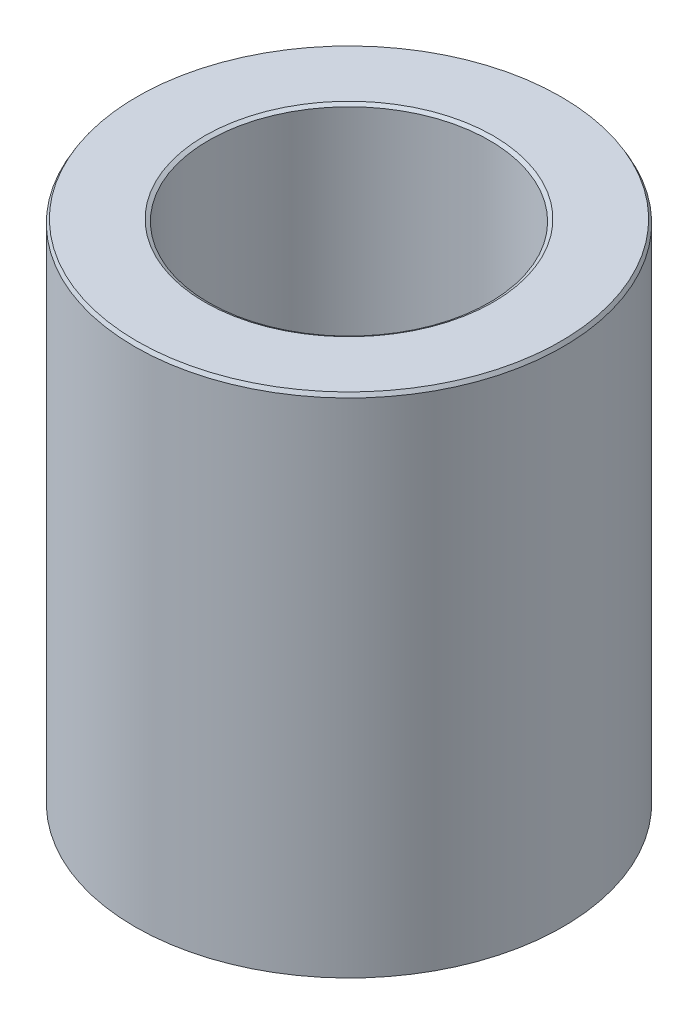
from build123d import *
from OCP.BRepFilletAPI import BRepFilletAPI_MakeChamfer

# Parameters (mm, degrees)
SKETCH1_R           = 55
BOSS_EXTRUDE1_DEPTH = 130.584568869
SKETCH2_R           = 36.095714522
CUT_EXTRUDE1_DEPTH  = 152.994505252
CHAMFER1_SIZE       = 0.95890999
CHAMFER1_SIZE2      = 0.553626941


with BuildPart() as part:
    # Sketch1 → Boss-Extrude1 (new body)
    with BuildSketch(Plane(origin=(0, 0, 0), x_dir=(1, 0, 0), z_dir=(0, 1, 0))):
        Circle(SKETCH1_R)
    extrude(amount=BOSS_EXTRUDE1_DEPTH)

    # Sketch2 → Cut-Extrude1 (cut, through all)
    with BuildSketch(Plane(origin=(0, 0, 0), x_dir=(1, 0, 0), z_dir=(0, 1, 0))):
        Circle(SKETCH2_R)
    extrude(amount=CUT_EXTRUDE1_DEPTH, mode=Mode.SUBTRACT)

    # Chamfer1: one chamfer whose edges measure the first distance from different faces: ONE call of the kernel's chamfer builder (chamfer() names one face for all edges)
    chamfer1_edges_1 = [part.edges().sort_by_distance(p)[0] for p in [
        (-36.095714522, 130.584568869, 0),
    ]]
    chamfer1_side_1 = [part.faces().sort_by_distance(p)[0] for p in [
        (-53.444365081, 130.584568869, 0),
    ]]
    chamfer1_edges_2 = [part.edges().sort_by_distance(p)[0] for p in [
        (-36.095714522, 0, 0),
    ]]
    chamfer1_side_2 = [part.faces().sort_by_distance(p)[0] for p in [
        (-36.095714522, 65.292284434, 0),
    ]]
    chamfer1_edges_3 = [part.edges().sort_by_distance(p)[0] for p in [
        (-55, 0, 0),
    ]]
    chamfer1_side_3 = [part.faces().sort_by_distance(p)[0] for p in [
        (-53.444365081, 0, 0),
    ]]
    chamfer1_edges_4 = [part.edges().sort_by_distance(p)[0] for p in [
        (-55, 130.584568869, 0),
    ]]
    chamfer1_side_4 = [part.faces().sort_by_distance(p)[0] for p in [
        (-55, 65.292284434, 0),
    ]]
    chamfer1 = BRepFilletAPI_MakeChamfer(part.part.solid().wrapped)
    for e in chamfer1_edges_1:
        chamfer1.Add(CHAMFER1_SIZE, CHAMFER1_SIZE2, e.wrapped, chamfer1_side_1[0].wrapped)  # the first distance lies on this face
    for e in chamfer1_edges_2:
        chamfer1.Add(CHAMFER1_SIZE, CHAMFER1_SIZE2, e.wrapped, chamfer1_side_2[0].wrapped)  # the first distance lies on this face
    for e in chamfer1_edges_3:
        chamfer1.Add(CHAMFER1_SIZE, CHAMFER1_SIZE2, e.wrapped, chamfer1_side_3[0].wrapped)  # the first distance lies on this face
    for e in chamfer1_edges_4:
        chamfer1.Add(CHAMFER1_SIZE, CHAMFER1_SIZE2, e.wrapped, chamfer1_side_4[0].wrapped)  # the first distance lies on this face
    add(Compound.cast(chamfer1.Shape()), mode=Mode.REPLACE)


solid = part.part
